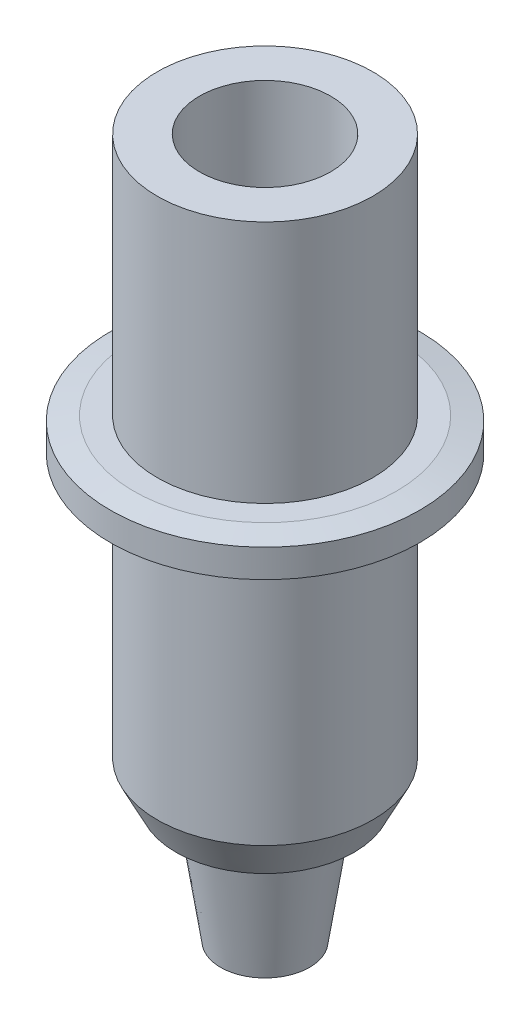
from build123d import *


with BuildPart() as part:
    # Sketch1 → Revolve1 (revolve)
    with BuildSketch(Plane.XY):
        Polygon((0, 0), (2.375, 0), (3.2, 5.5), (3.2, 6.5), (4.75, 6.5), (5.75, 8.5), (5.75, 22.3), (7, 22.3), (8.25, 22.55), (8.25, 24.05), (7, 24.3), (5.75, 24.3), (5.75, 37.3), (0, 37.3), align=None)
    revolve(axis=Axis((0, -143.950460456, 0), (0, 1, 0)))

    # Sketch2 → Cut-Revolve1 (revolve, cut)
    with BuildSketch(Plane.XY):
        Polygon((1.2, 0), (1.2, 2), (2.25, 2), (2.25, 14.18), (3.5, 14.18), (3.5, 37.3), (0, 37.3), (0, 0), align=None)
    revolve(axis=Axis((0, -1000, 0), (0, 1, 0)), mode=Mode.SUBTRACT)


solid = part.part
